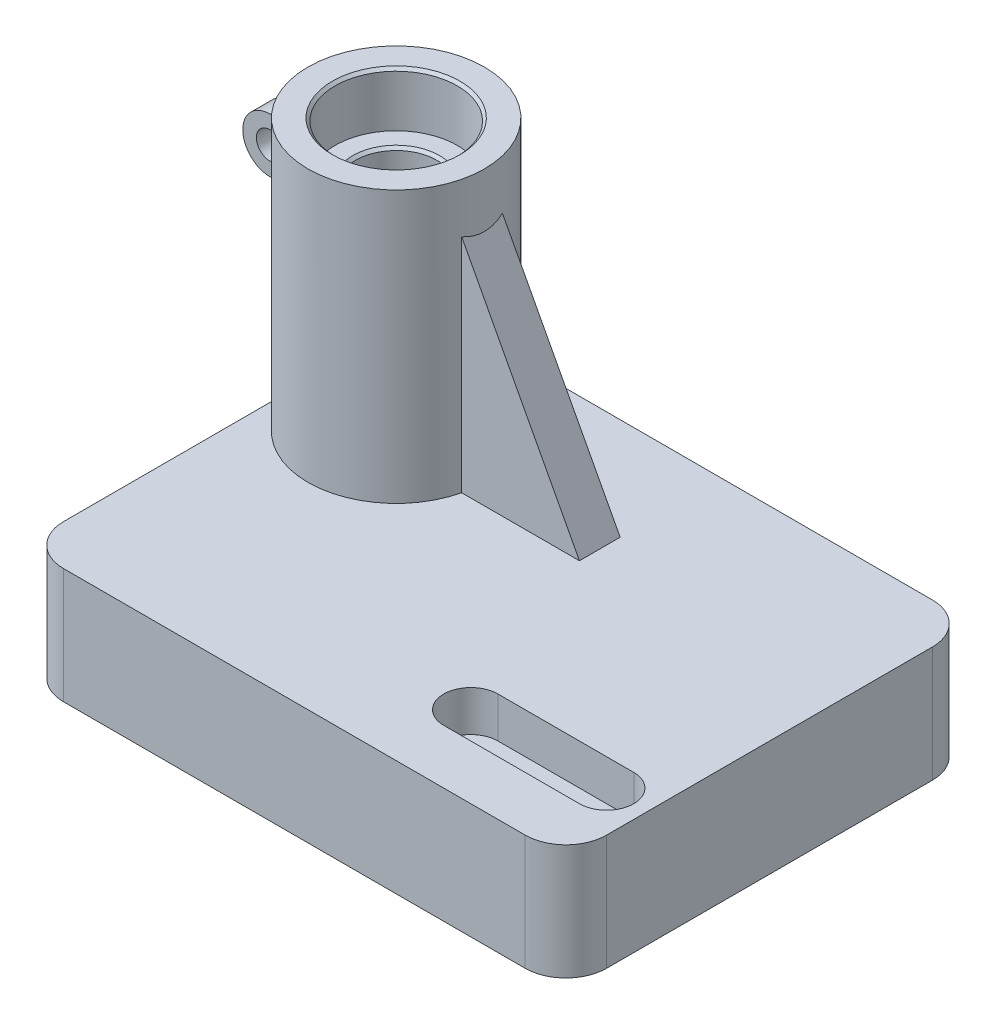
from build123d import *

# Parameters (mm, degrees)
SKETCH1_W                = 400
SKETCH1_H                = 300
BOSS_EXTRUDE1_DEPTH      = 85
SKETCH2_R                = 65
BOSS_EXTRUDE2_DEPTH      = 200
FILLET1_R                = 30
CUT_EXTRUDE1_DEPTH       = 30
RIB1_REACH               = 408.602
SKETCH4_WALL_W           = 996.380250876
SKETCH4_WALL_H           = 30
SKETCH6_R                = 30
CUT_EXTRUDE2_DEPTH       = 380.110801745
SKETCH7_R                = 45
CUT_EXTRUDE3_DEPTH       = 40
CUT_EXTRUDE4_START       = -40
SKETCH8_R                = 45
CUT_EXTRUDE4_DEPTH       = 40
CHAMFER1_SIZE            = 2
BOSS_EXTRUDE3_REACH      = 547.275
BOSS_EXTRUDE3_END_RADIUS = 65
SKETCH9_W                = 16
SKETCH9_H                = 40
FILLET2_R                = 20
CUT_EXTRUDE5_DEPTH       = 424.826615493
CUT_EXTRUDE5_DEPTH_BACK  = 424.826615493
SKETCH10_R               = 10


with BuildPart() as part:
    # Sketch1 → Boss-Extrude1 (new body)
    with BuildSketch(Plane(origin=(0, 0, 0), x_dir=(1, 0, 0), z_dir=(0, 1, 0))):
        Rectangle(SKETCH1_W, SKETCH1_H)
    extrude(amount=BOSS_EXTRUDE1_DEPTH)

    # Sketch2 → Boss-Extrude2 (add)
    with BuildSketch(Plane(origin=(0, 85, 0), x_dir=(1, 0, 0), z_dir=(0, 1, 0))):
        with Locations(Location((-135, 60, 0), (0, 0, 180))):
            Circle(SKETCH2_R)
    extrude(amount=BOSS_EXTRUDE2_DEPTH)

    # Fillet1
    fillet1_edges = [part.edges().sort_by_distance(p)[0] for p in [
        (200, 42.5, 150),
        (-200, 42.5, 150),
        (-200, 42.5, -150),
        (200, 42.5, -150),
    ]]
    fillet(fillet1_edges, radius=FILLET1_R)

    # Sketch3 → Cut-Extrude1 (cut)
    with BuildSketch(Plane(origin=(0, 85, 0), x_dir=(1, 0, 0), z_dir=(0, 1, 0))):
        with BuildLine():
            Line((70, -70), (170, -70))
            ThreePointArc((170, -70), (190, -90), (170, -110))
            Line((170, -110), (70, -110))
            ThreePointArc((70, -110), (50, -90), (70, -70))
        make_face()
    extrude(amount=-CUT_EXTRUDE1_DEPTH, mode=Mode.SUBTRACT)

    # Sketch4 wall → Rib1 (add, up to next)
    with BuildSketch(Plane(origin=(-27.5, 165, -60), x_dir=(-0.469155225962, 0.883115719457, 0), z_dir=(-0.883115719457, -0.469155225962, 0)), mode=Mode.PRIVATE) as rib1_sk1:
        Rectangle(SKETCH4_WALL_W, SKETCH4_WALL_H)
    rib1_tool1 = extrude(rib1_sk1.sketch, amount=RIB1_REACH, mode=Mode.PRIVATE) - part.part
    add(rib1_tool1.solids().sort_by_distance((-27.5, 165, -60))[0])

    # Sketch6 → Cut-Extrude2 (cut, through all)
    with BuildSketch(Plane(origin=(0, 285, 0), x_dir=(1, 0, 0), z_dir=(0, 1, 0))):
        with Locations(Location((-135, 60, 0), (0, 0, 270))):
            Circle(SKETCH6_R)
    extrude(amount=-CUT_EXTRUDE2_DEPTH, mode=Mode.SUBTRACT)

    # Sketch7 → Cut-Extrude3 (cut)
    with BuildSketch(Plane(origin=(0, 0, 0), x_dir=(1, 0, 0), z_dir=(0, 1, 0))):
        with Locations(Location((-135, 60, 0), (0, 0, 270))):
            Circle(SKETCH7_R)
    extrude(amount=CUT_EXTRUDE3_DEPTH, mode=Mode.SUBTRACT)

    # Sketch8 → Cut-Extrude4 (cut)
    with BuildSketch(Plane(origin=(0, 285, 0), x_dir=(1, 0, 0), z_dir=(0, 1, 0)).offset(CUT_EXTRUDE4_START)):
        with Locations(Location((-135, 60, 0), (0, 0, 270))):
            Circle(SKETCH8_R)
    extrude(amount=CUT_EXTRUDE4_DEPTH, mode=Mode.SUBTRACT)

    # Chamfer1
    chamfer1_edges = [part.edges().sort_by_distance(p)[0] for p in [
        (-135, 285, -105),
        (-135, 245, -90),
        (-135, 40, -90),
        (-135, 0, -105),
    ]]
    chamfer(chamfer1_edges, length=CHAMFER1_SIZE)

    # Boss-Extrude3: up to this cylinder (the profile starts outside it)
    boss_extrude3_end = Plane(origin=(-135, 229, -60), z_dir=(0, -1, 0)) * Cylinder(BOSS_EXTRUDE3_END_RADIUS, 1225.55, mode=Mode.PRIVATE)
    # Sketch9 → Boss-Extrude3 (add, up to the surface)
    with BuildSketch(Plane.ZY.offset(240), mode=Mode.PRIVATE) as boss_extrude3_sk1:
        with Locations((-60, 229)):
            Rectangle(SKETCH9_W, SKETCH9_H)
    boss_extrude3_tool1 = extrude(boss_extrude3_sk1.sketch, amount=-BOSS_EXTRUDE3_REACH, mode=Mode.PRIVATE) - boss_extrude3_end
    add(boss_extrude3_tool1.solids().sort_by_distance((-240, 229, -60))[0])

    # Fillet2
    fillet2_edges = [part.edges().sort_by_distance(p)[0] for p in [
        (-240, 209, -60),
        (-240, 249, -60),
    ]]
    fillet(fillet2_edges, radius=FILLET2_R - 0.0001)  # a hair under: the kernel refuses the full size

    # Sketch10 → Cut-Extrude5 (cut, two sides: drawn at the far end of the back side and taken through both)
    with BuildSketch(Plane.XY.offset(-52).offset(-CUT_EXTRUDE5_DEPTH_BACK)):
        with Locations(Location((-220, 229, 0), (0, 0, 270))):
            Circle(SKETCH10_R)
    extrude(amount=CUT_EXTRUDE5_DEPTH + CUT_EXTRUDE5_DEPTH_BACK, mode=Mode.SUBTRACT)


solid = part.part
